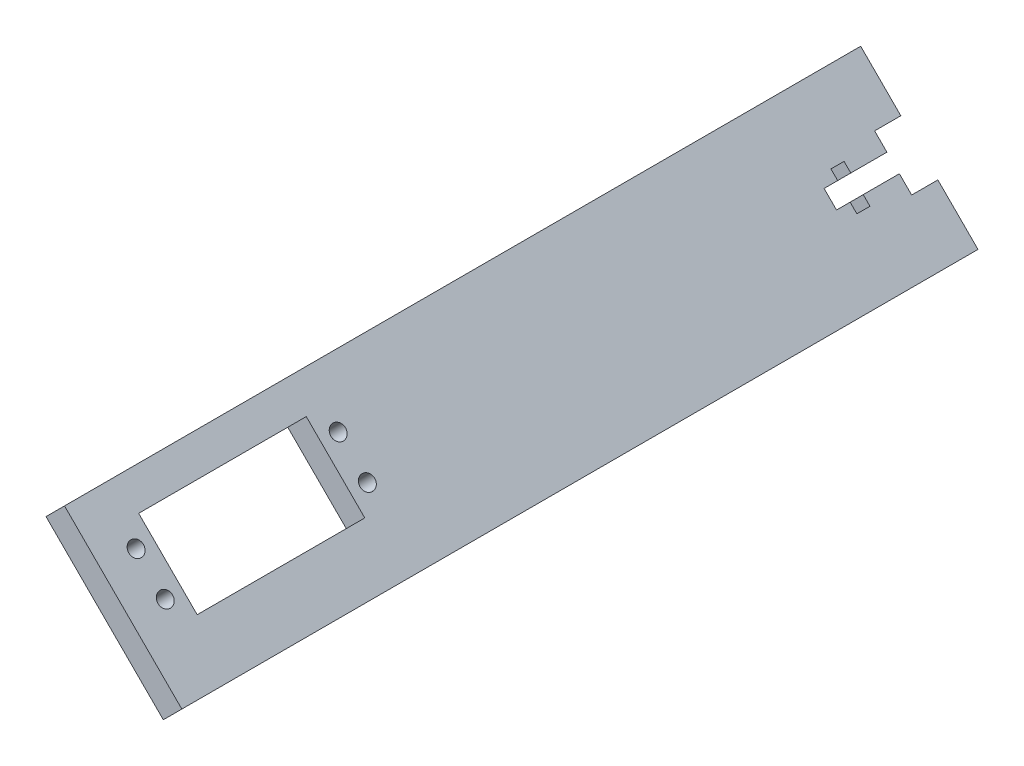
from build123d import *

# Parameters (mm, degrees)
BOSS_EXTRUDE1_DEPTH = 186.69
CUT_EXTRUDE1_DEPTH  = 210.486220751
BOSS_EXTRUDE2_DEPTH = 6.35
SKETCH5_W           = 40.64
SKETCH5_H           = 20.066
CUT_EXTRUDE2_DEPTH  = 210.486220751
SKETCH6_R           = 1.778
CUT_EXTRUDE4_DEPTH  = 210.486220751


with BuildPart() as part:
    # Sketch2 → Boss-Extrude1 (new body)
    with BuildSketch(Plane.XY):
        Polygon((-71.1004567, -144.044147058), (-75.59058476, -148.534275118), (-47.146344636, -176.978515243), (-42.656216575, -172.488387182), align=None)
    extrude(amount=BOSS_EXTRUDE1_DEPTH)

    # Sketch3 → Cut-Extrude1 (cut, through all)
    with BuildSketch(Plane(origin=(-112.062429939, -112.062429939, 0), x_dir=(0, 0, 1), z_dir=(-0.7071067811865479, -0.7071067811865472, 0))):
        Polygon((0, -69.558493175), (0, -73.825693175), (8.763, -73.825693175), (8.763, -76.137093175), (11.938, -76.137093175), (11.938, -73.825693175), (15.24, -73.825693175), (15.24, -69.558493175), (11.938, -69.558493175), (11.938, -67.247093175), (8.763, -67.247093175), (8.763, -69.558493175), align=None)
    extrude(amount=-CUT_EXTRUDE1_DEPTH, mode=Mode.SUBTRACT)

    # Sketch4 → Boss-Extrude2 (add)
    with BuildSketch(Plane(origin=(0, 0, 0), x_dir=(-1, 0, 0), z_dir=(0, 0, -1))):
        Polygon((75.59058476, -148.534275118), (65.858592758, -158.26626712), (61.368464698, -153.77613906), (71.1004567, -144.044147058), align=None)
        Polygon((42.656216575, -172.488387182), (52.388208577, -162.756395181), (56.878336637, -167.246523241), (47.146344636, -176.978515243), align=None)
    extrude(amount=BOSS_EXTRUDE2_DEPTH)

    # Sketch5 → Cut-Extrude2 (cut, through all)
    with BuildSketch(Plane(origin=(-107.572301879, -107.572301879, 0), x_dir=(0, 0, -1), z_dir=(0.7071067811865476, 0.7071067811865476, 0))):
        with Locations((-153.67, -69.072208253)):
            Rectangle(SKETCH5_W, SKETCH5_H)
    extrude(amount=-CUT_EXTRUDE2_DEPTH, mode=Mode.SUBTRACT)

    # Sketch6 → Cut-Extrude4 (cut, through all)
    with BuildSketch(Plane(origin=(-107.572301879, -107.572301879, 0), x_dir=(0, 0, -1), z_dir=(0.7071067811865476, 0.7071067811865476, 0))):
        with Locations((-178.17, -64.072208253)):
            Circle(SKETCH6_R)
        with Locations((-178.17, -74.072208253)):
            Circle(SKETCH6_R)
        with Locations((-129.17, -64.072208253)):
            Circle(SKETCH6_R)
        with Locations((-129.17, -74.072208253)):
            Circle(SKETCH6_R)
    extrude(amount=-CUT_EXTRUDE4_DEPTH, mode=Mode.SUBTRACT)


solid = part.part
